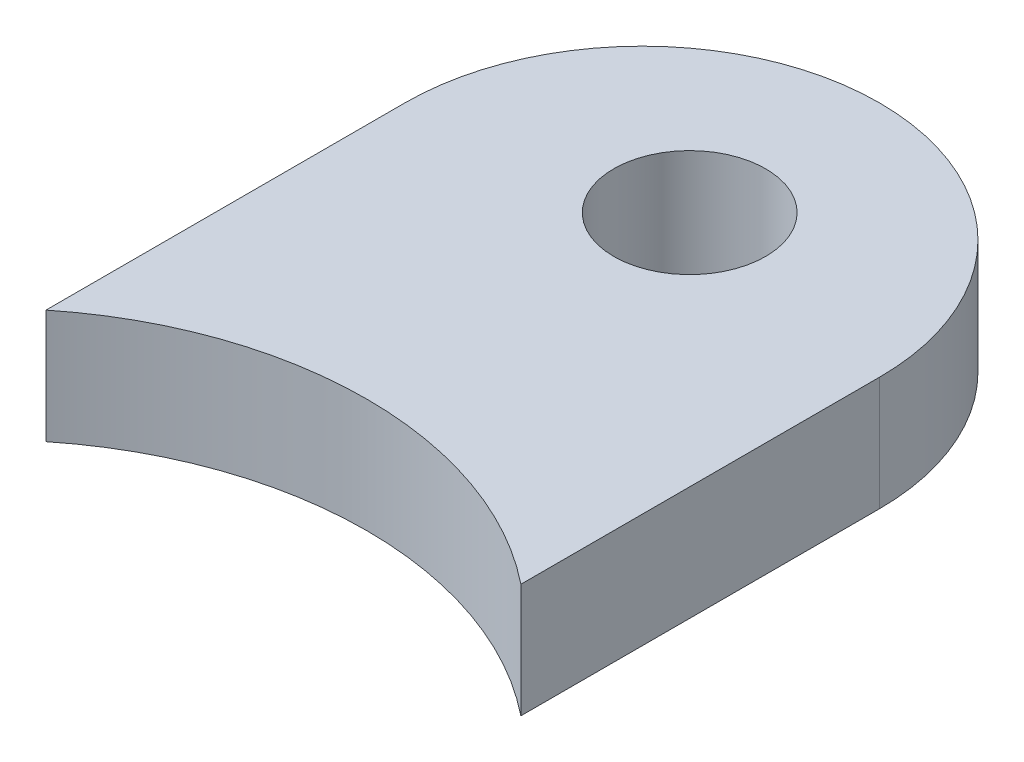
from build123d import *

# Parameters (mm, degrees)
SKETCH1_W           = 25
SKETCH1_H           = 35
SKETCH1_R           = 4
BOSS_EXTRUDE1_DEPTH = 6
FILLET1_R           = 12.5
SKETCH2_R           = 20
CUT_EXTRUDE1_DEPTH  = 6


with BuildPart() as part:
    # Sketch1 → Boss-Extrude1 (new body)
    with BuildSketch(Plane(origin=(0, 0, 0), x_dir=(1, 0, 0), z_dir=(0, 1, 0))):
        with Locations((12.5, 17.5)):
            Rectangle(SKETCH1_W, SKETCH1_H)
        with Locations(Location((12.5, 25, 0), (0, 0, 270))):
            Circle(SKETCH1_R, mode=Mode.SUBTRACT)
    extrude(amount=BOSS_EXTRUDE1_DEPTH)

    # Fillet1
    fillet1_edges = [part.edges().sort_by_distance(p)[0] for p in [
        (25, 3, -35),
        (0, 3, -35),
    ]]
    fillet(fillet1_edges, radius=FILLET1_R - 0.0001)  # a hair under: the kernel refuses the full size

    # Sketch2 → Cut-Extrude1 (cut)
    with BuildSketch(Plane(origin=(0, 6, 0), x_dir=(1, 0, 0), z_dir=(0, 1, 0))):
        with Locations((12.5, -12)):
            Circle(SKETCH2_R)
    extrude(amount=-CUT_EXTRUDE1_DEPTH, mode=Mode.SUBTRACT)


solid = part.part
